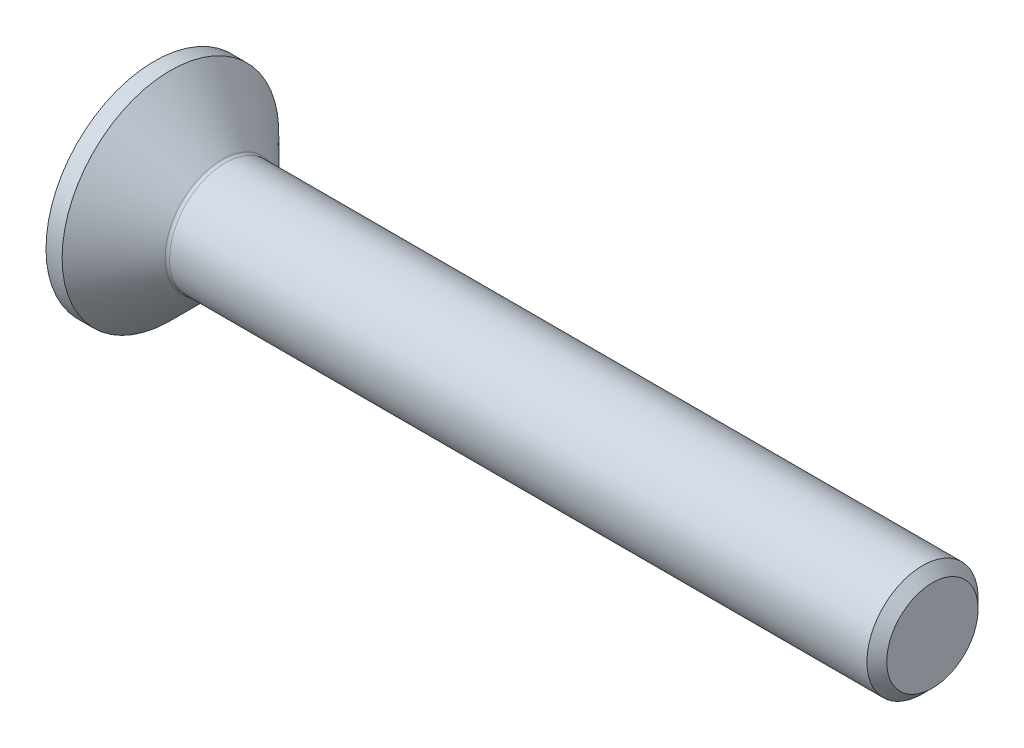
from build123d import *

# Parameters (mm, degrees)
FILLET1_R   = 0.2
HEX_START   = -1.9
HEX_2_DEPTH = 1.9


with BuildPart() as part:
    # BodySke → BaseBody (revolve)
    with BuildSketch(Plane.XY, mode=Mode.PRIVATE) as basebody_sk:
        Polygon((0, 0), (0, 4.875), (0.725, 4.875), (3.1, 2.5), (34.555, 2.5), (35, 2.055), (35, 0), align=None)
    revolve(basebody_sk.sketch.rotate(Axis((0, 0, 0), (1, 0, 0)), 90), axis=Axis((0, 0, 0), (1, 0, 0)))

    # Fillet1
    fillet1_edges = [part.edges().sort_by_distance(p)[0] for p in [
        (3.1, 0, -2.5),
    ]]
    fillet(fillet1_edges, radius=FILLET1_R)

    # Hex 2: read off the stored shape, not the designer's step
    # Hex 2 outline → Hex 2 (cut)
    with BuildSketch(Plane.ZY.offset(HEX_START)):
        Polygon((-1.5, -0.866025404), (0, -1.732050808), (1.5, -0.866025404), (1.5, 0.866025404), (0, 1.732050808), (-1.5, 0.866025404), align=None)
    extrude(amount=HEX_2_DEPTH, mode=Mode.SUBTRACT)

    # Hex 2 2 outline → Hex 2 2 (revolve, cut)
    with BuildSketch(Plane.YX):
        Polygon((1.5, 1.9), (0, 2.766025404), (0, 1.9), align=None)
    revolve(axis=Axis((0, 0, 0), (1, 0, 0)), mode=Mode.SUBTRACT)


solid = part.part
